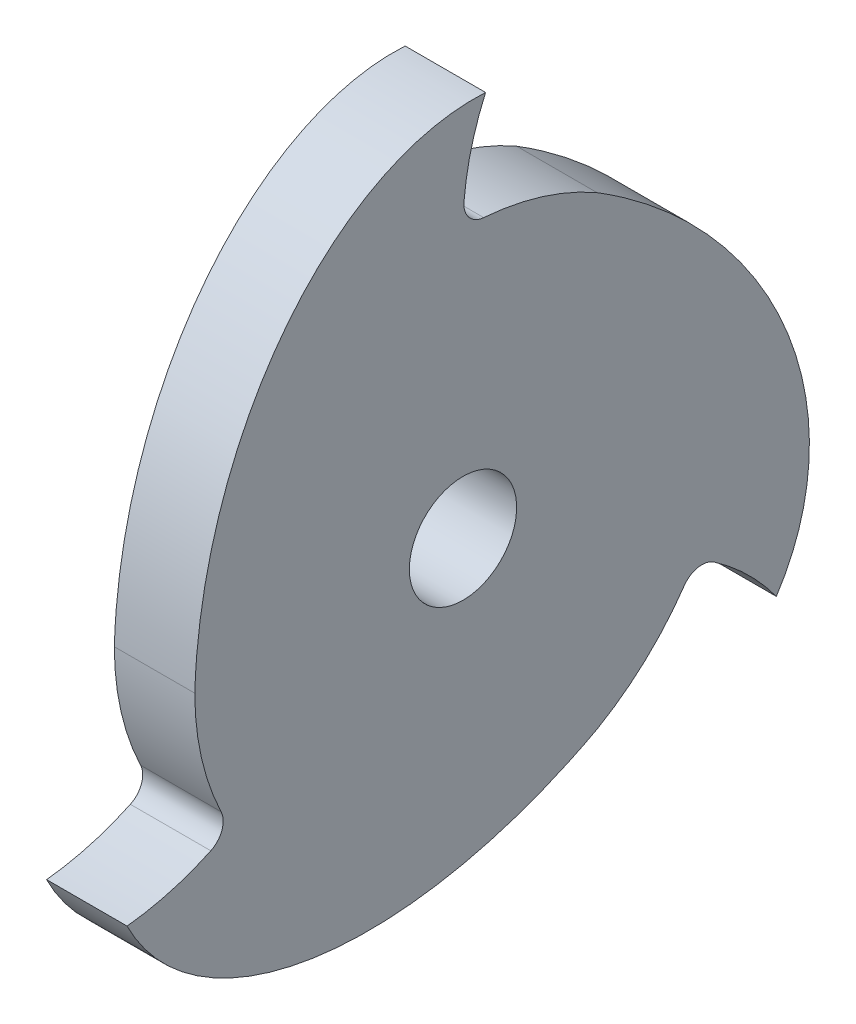
from build123d import *

# Parameters (mm, degrees)
SKETCH1_R           = 6.35
BOSS_EXTRUDE3_DEPTH = 9.525
FILLET3_R           = 2.54


with BuildPart() as part:
    # Sketch1 → Boss-Extrude3 (new body)
    with BuildSketch(Plane(origin=(0, 0, 0), x_dir=(0, 0, -1), z_dir=(1, 0, 0))):
        with BuildLine():
            ThreePointArc((15.875, 27.49630657), (8.217504682, 30.668144985), (0, 31.75))
            ThreePointArc((0, 31.75), (0.675988504, 38.199887052), (2.67457554, 44.369461859))
            add(Edge.make_bspline(
                [(2.67457554, 44.369461859), (-5.936841316, 44.888555036), (-16.617497579, 41.289527296), (-25.794118526, 30.860747918), (-30.384735314, 16.270086611), (-31.590640959, 3.039982239), (-31.64854711, 2.2709847), (-31.694157512, 1.507588673), (-31.727844303, 0.75041163), (-31.75, 0)],
                knots=[3.141592654, 3.141592654, 3.141592654, 3.141592654, 3.141592654, 3.141592654, 4.660979846, 4.660979846, 4.660979846, 4.660979846, 4.7553811, 4.7553811, 4.7553811, 4.7553811, 4.7553811, 4.7553811], degree=5, weights=[1, 1, 0.97033237, 0.968198369, 1, 1, 1.000000154, 1.000000177, 1, 1]))
            ThreePointArc((-31.75, 0), (-30.668144985, -8.217504682), (-27.49630657, -15.875))
            ThreePointArc((-27.49630657, -15.875), (-33.420066861, -18.514520309), (-39.762368892, -19.868480568))
            add(Edge.make_bspline(
                [(-39.762368892, -19.868480568), (-35.906208342, -27.585732916), (-27.449030759, -35.035938699), (-13.829132414, -37.768735871), (1.102059329, -34.448995975), (13.162618634, -28.878288712), (13.857543113, -28.54393814), (14.541468667, -28.201739894), (15.214046616, -27.852324988), (15.875, -27.49630657)],
                knots=[0, 0, 0, 0, 0, 0, 1.519387193, 1.519387193, 1.519387193, 1.519387193, 1.613788447, 1.613788447, 1.613788447, 1.613788447, 1.613788447, 1.613788447], degree=5, weights=[1, 1, 0.97033237, 0.968198369, 1, 1, 1.000000154, 1.000000177, 1, 1]))
            ThreePointArc((15.875, -27.49630657), (22.450640303, -22.450640303), (27.49630657, -15.875))
            ThreePointArc((27.49630657, -15.875), (32.744078357, -19.685366743), (37.087793352, -24.500981292))
            add(Edge.make_bspline(
                [(37.087793352, -24.500981292), (41.843049658, -17.30282212), (44.066528338, -6.253588597), (39.62325094, 6.907987953), (29.282675984, 18.178909363), (18.428022326, 25.838306473), (17.791003997, 26.27295344), (17.152688846, 26.694151221), (16.513797686, 27.101913358), (15.875, 27.49630657)],
                knots=[0, 0, 0, 0, 0, 0, 1.519387193, 1.519387193, 1.519387193, 1.519387193, 1.613788447, 1.613788447, 1.613788447, 1.613788447, 1.613788447, 1.613788447], degree=5, weights=[1, 1, 0.97033237, 0.968198369, 1, 1, 1.000000154, 1.000000177, 1, 1]))
        make_face()
        Circle(SKETCH1_R, mode=Mode.SUBTRACT)
    extrude(amount=BOSS_EXTRUDE3_DEPTH)

    # Fillet3
    fillet3_edges = [part.edges().sort_by_distance(p)[0] for p in [
        (4.7625, -15.875, 27.49630657),
        (4.7625, -15.875, -27.49630657),
        (4.7625, 31.75, 0),
    ]]
    fillet(fillet3_edges, radius=FILLET3_R)


solid = part.part
